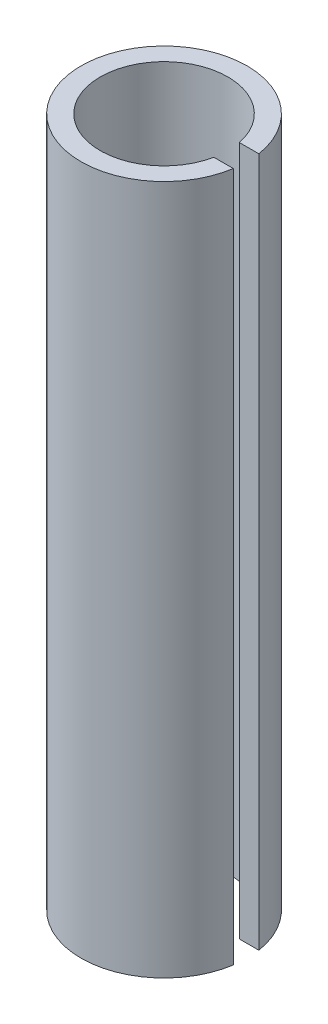
from build123d import *

# Parameters (mm, degrees)
BOSS_EXTRUDE1_DEPTH = 27


with BuildPart() as part:
    # Sketch1 → Boss-Extrude1 (new body)
    with BuildSketch(Plane(origin=(0, 0, 0), x_dir=(1, 0, 0), z_dir=(0, 1, 0))):
        with BuildLine():
            ThreePointArc((2.449489743, -0.5), (-2.5, 0), (2.449489743, 0.5))
            Line((2.449489743, 0.5), (3.211308145, 0.5))
            ThreePointArc((3.211308145, 0.5), (-3.25, 0), (3.211308145, -0.5))
            Line((3.211308145, -0.5), (2.449489743, -0.5))
        make_face()
    extrude(amount=BOSS_EXTRUDE1_DEPTH)


solid = part.part
